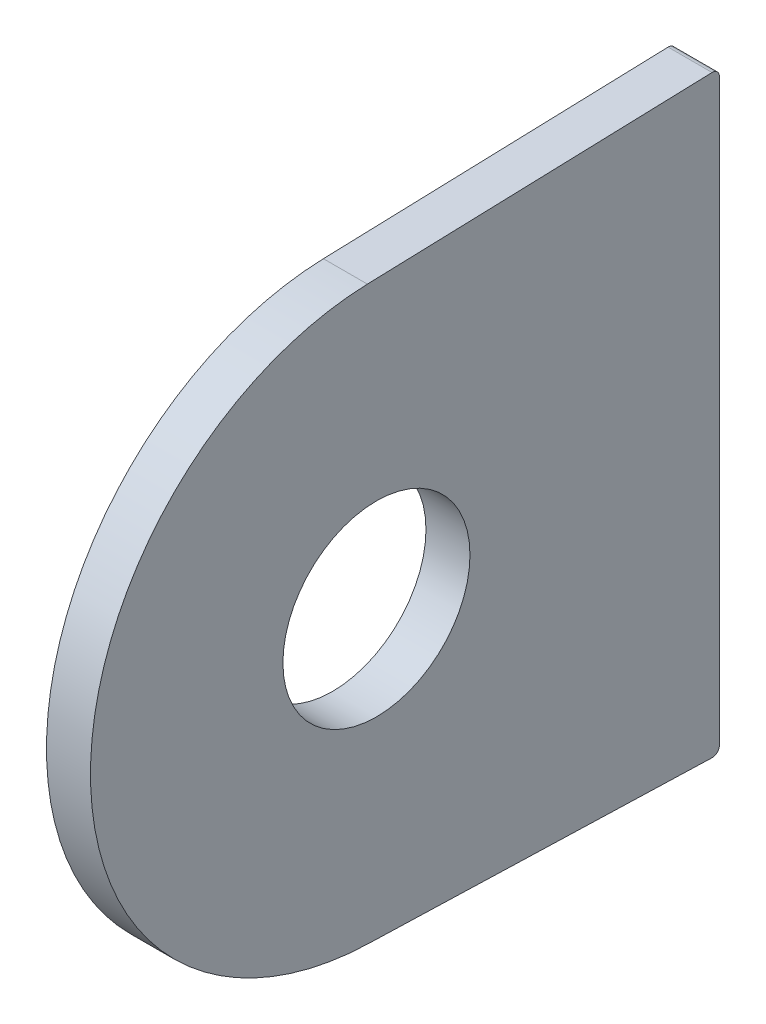
from build123d import *

# Parameters (mm, degrees)
BOSS_EXTRUDE1_DEPTH   = 1.5875
FILLET1_R             = 0.508
FILLET2_R             = 0.508
M12_CLEARANCE_HOLE1_D = 13.5


with BuildPart() as part:
    # Sketch1 → Boss-Extrude1 (new, symmetric)
    with BuildSketch(Plane(origin=(0, 0, 0), x_dir=(0, 0, -1), z_dir=(1, 0, 0))):
        with BuildLine():
            Line((-0.652990494, -20.627166787), (24.747009506, -21.43125))
            Line((24.747009506, -21.43125), (24.747009506, 21.43125))
            Line((24.747009506, 21.43125), (-0.652990494, 20.627166787))
            ThreePointArc((-0.652990494, 20.627166787), (-20.6375, 0), (-0.652990494, -20.627166787))
        make_face()
    extrude(amount=BOSS_EXTRUDE1_DEPTH, both=True)

    # Fillet1
    fillet1_edges = [part.edges().sort_by_distance(p)[0] for p in [
        (0, -21.43125, -24.747009506),
    ]]
    fillet(fillet1_edges, radius=FILLET1_R)

    # Fillet2
    fillet2_edges = [part.edges().sort_by_distance(p)[0] for p in [
        (0, 21.43125, -24.747009506),
    ]]
    fillet(fillet2_edges, radius=FILLET2_R)

    # M12 Clearance Hole1 (through all)
    with Locations(Plane.ZY.offset(1.5875)):
        with Locations((0, 0)):
            Hole(M12_CLEARANCE_HOLE1_D / 2)


solid = part.part
